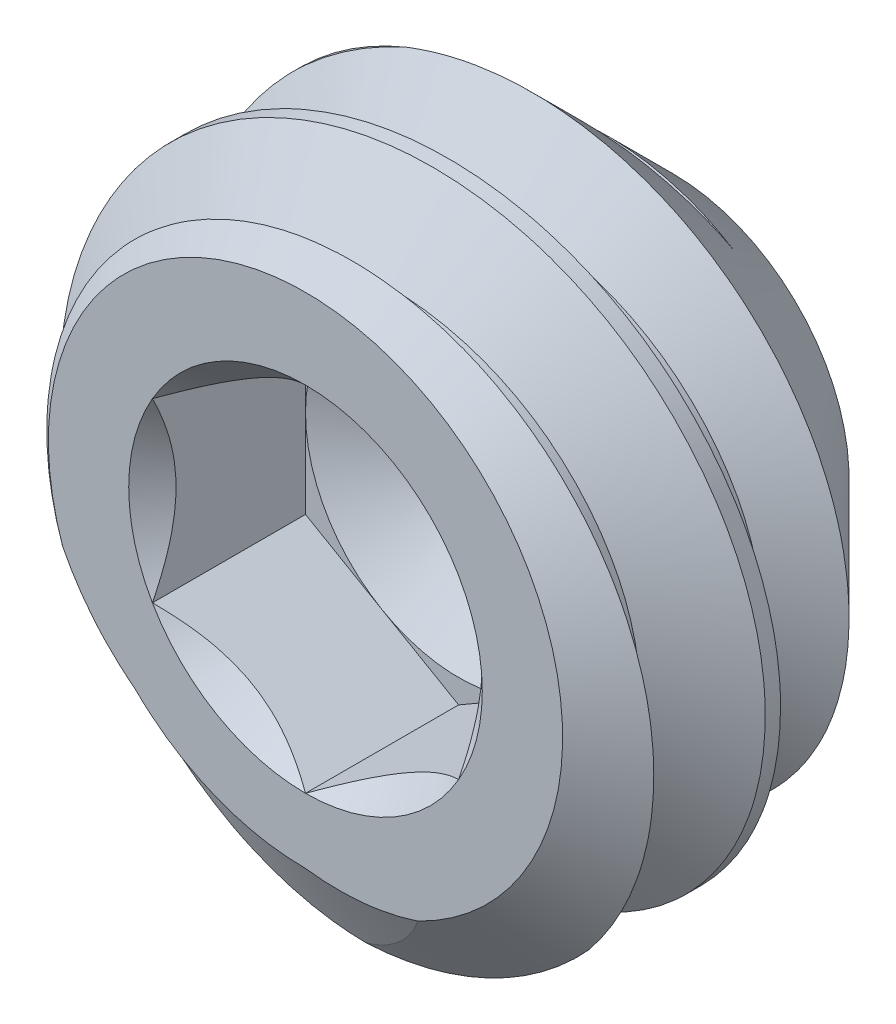
from build123d import *

# Parameters (mm, degrees)
CUT_SWEEP2_PITCH    = 0.79375
CUT_EXTRUDE10_DEPTH = 0.9921875


with BuildPart() as part:
    # Sketch22 → Revolve1 (revolve)
    with BuildSketch(Plane(origin=(0, 0, 0), x_dir=(0, 0, -1), z_dir=(1, 0, 0)), mode=Mode.PRIVATE) as revolve1_sk:
        Polygon((-0.847743495, 0), (-0.847743495, 1.66624), (-0.556065043, 2.0828), (0.592007812, 2.0828), (1.533506505, 1.141301307), (0.847743495, 0), align=None)
    revolve(revolve1_sk.sketch.rotate(Axis((0, 0, -0.847743495), (0, 0, -1)), 180), axis=Axis((0, 0, -0.847743495), (0, 0, -1)))

    # Cut-Sweep2: the profile of Sketch28 profile screwed along a right-hand helix of 4 turns, 8 arcs to a turn; built about Z, then put on its axis
    cut_sweep2_z = Axis((0, 0, 0), (0, 0, 1))
    cut_sweep2_corners = [(2.0831, 0, 0.000173205), (2.0831, 0, -0.694704455), (1.567244252, 0, -0.396875), (1.567244252, 0, -0.29765625)]
    with BuildLine(mode=Mode.PRIVATE) as cut_sweep2_profile:
        Line(cut_sweep2_corners[0], cut_sweep2_corners[1])
        Line(cut_sweep2_corners[1], cut_sweep2_corners[2])
        Line(cut_sweep2_corners[2], cut_sweep2_corners[3])
        Line(cut_sweep2_corners[3], cut_sweep2_corners[0])
    cut_sweep2_cap = Face(cut_sweep2_profile.wire())
    cut_sweep2_turn_angles = [0, 22.5, 45, 67.5, 90, 112.5, 135, 157.5, 180, 202.5, 225, 247.5, 270, 292.5, 315, 337.5, 360]
    cut_sweep2_turn_weights = [1, 0.9238795325112867, 1, 0.9238795325112867, 1, 0.9238795325112867, 1, 0.9238795325112867, 1, 0.9238795325112867, 1, 0.9238795325112867, 1, 0.9238795325112867, 1, 0.9238795325112867, 1]
    cut_sweep2_turn_rails = [Edge.make_bspline([Vector(p[0], p[1], 0).rotate(cut_sweep2_z, cut_sweep2_turn_angles[k]) / cut_sweep2_turn_weights[k] + Vector(0, 0, p[2] + CUT_SWEEP2_PITCH * cut_sweep2_turn_angles[k] / 360) for k in range(17)], [0, 0, 0, 1, 1, 2, 2, 3, 3, 4, 4, 5, 5, 6, 6, 7, 7, 8, 8, 8], 2, cut_sweep2_turn_weights) for p in cut_sweep2_corners]
    cut_sweep2_turn_sides = [Face.make_surface_from_curves(cut_sweep2_turn_rails[p[0]], cut_sweep2_turn_rails[p[1]]) for p in [(0, 1), (1, 2), (2, 3), (3, 0)]]
    cut_sweep2 = Plane(origin=(0, 0, -1.533506505), x_dir=(0, 1, 0), z_dir=(0, 0, 1)) * Solid(Shell([*[p.moved(Location((0, 0, CUT_SWEEP2_PITCH * i))) for i in range(4) for p in cut_sweep2_turn_sides], cut_sweep2_cap, cut_sweep2_cap.rotate(cut_sweep2_z, 1440).moved(Location((0, 0, CUT_SWEEP2_PITCH * 1440 / 360)))]))
    add(cut_sweep2, mode=Mode.SUBTRACT)

    # Sketch23 → Cut-Extrude10 (cut)
    with BuildSketch(Plane.XY.offset(0.847743495)):
        Polygon((0, 1.14567944), (-0.9921875, 0.57283972), (-0.9921875, -0.57283972), (0, -1.14567944), (0.9921875, -0.57283972), (0.9921875, 0.57283972), align=None)
    extrude(amount=-CUT_EXTRUDE10_DEPTH, mode=Mode.SUBTRACT)

    # Cut-Extrude11 cone 1 section (through the dimple's axis) → Cut-Extrude11 (revolve, cut)
    with BuildSketch(Plane(origin=(0, 0, 0.847743495), x_dir=(0, -1, 0), z_dir=(1, 0, 0))):
        Polygon((0, 0), (1.14567944, 0), (0, 1.14567944), align=None)
    revolve(axis=Axis((0, 0, 0.847743495), (0, 0, -1)), mode=Mode.SUBTRACT)

    # Cut-Extrude12 cone 1 section (through the dimple's axis) → Cut-Extrude12 (revolve, cut)
    with BuildSketch(Plane(origin=(0, 0, -0.144444005), x_dir=(0, -1, 0), z_dir=(1, 0, 0))):
        Polygon((0, 0), (0.9921875, 0), (0, 0.57283972), align=None)
    revolve(axis=Axis((0, 0, -0.144444005), (0, 0, -1)), mode=Mode.SUBTRACT)


solid = part.part
